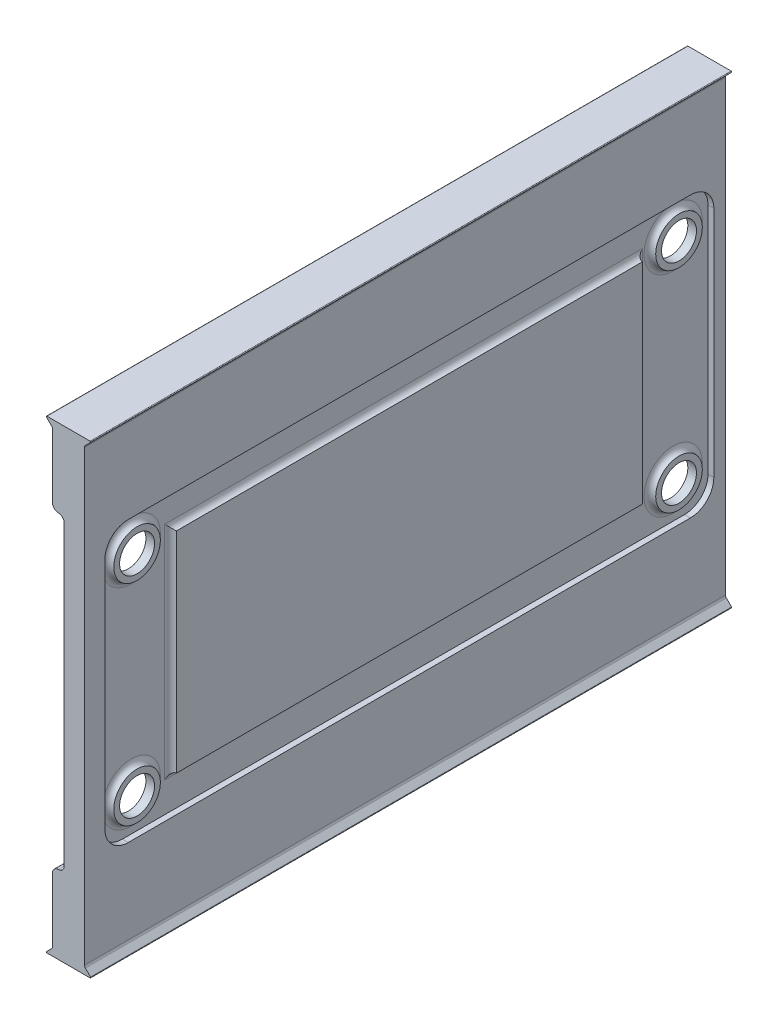
from build123d import *

# Parameters (mm, degrees)
BOSS_EXTRUDE1_DEPTH = 55
SKETCH2_R           = 2
SKETCH2_W           = 40
SKETCH2_H           = 18
CUT_EXTRUDE4_DEPTH  = 0.5
SKETCH7_R           = 1.5
CUT_EXTRUDE7_DEPTH  = 59.595908099
SKETCH8_R           = 3.75
CUT_EXTRUDE8_DEPTH  = 2
SKETCH9_W           = 55
SKETCH9_H           = 26.5
CUT_EXTRUDE9_DEPTH  = 1
FILLET1_R           = 0.5
FILLET2_R           = 0.5
FILLET3_R           = 0.5
FILLET4_R           = 0.5
FILLET5_R           = 0.5


with BuildPart() as part:
    # Sketch1 → Boss-Extrude1 (new body)
    with BuildSketch(Plane.XY):
        with BuildLine():
            Line((-1.854289322, 19.943670675), (1.854289322, 19.943670675))
            ThreePointArc((1.854289322, 19.943670675), (1.900483299, 19.912804847), (1.889644661, 19.858315336))
            Line((1.889644661, 19.858315336), (1.444669914, 19.413340589))
            ThreePointArc((1.444669914, 19.413340589), (1.390476726, 19.332234752), (1.371446609, 19.236563894))
            Line((1.371446609, 19.236563894), (1.371446609, -19.236563894))
            ThreePointArc((1.371446609, -19.236563894), (1.390476726, -19.332234752), (1.444669914, -19.413340589))
            Line((1.444669914, -19.413340589), (1.889644661, -19.858315336))
            ThreePointArc((1.889644661, -19.858315336), (1.900483299, -19.912804847), (1.854289322, -19.943670675))
            Line((1.854289322, -19.943670675), (-1.854289322, -19.943670675))
            ThreePointArc((-1.854289322, -19.943670675), (-1.900483299, -19.912804847), (-1.889644661, -19.858315336))
            Line((-1.889644661, -19.858315336), (-1.444669914, -19.413340589))
            ThreePointArc((-1.444669914, -19.413340589), (-1.390476726, -19.332234752), (-1.371446609, -19.236563894))
            Line((-1.371446609, -19.236563894), (-1.371446609, 19.236563894))
            ThreePointArc((-1.371446609, 19.236563894), (-1.390476726, 19.332234752), (-1.444669914, 19.413340589))
            Line((-1.444669914, 19.413340589), (-1.889644661, 19.858315336))
            ThreePointArc((-1.889644661, 19.858315336), (-1.900483299, 19.912804847), (-1.854289322, 19.943670675))
        make_face()
    extrude(amount=BOSS_EXTRUDE1_DEPTH)

    # Sketch2 → Cut-Extrude4 (cut)
    with BuildSketch(Plane(origin=(1.371446609, 0, 0), x_dir=(0, 0, -1), z_dir=(1, 0, 0))):
        with BuildLine():
            Line((-51.25, 12), (-3, 12))
            ThreePointArc((-3, 12), (-1.585786438, 11.414213562), (-1, 10))
            Line((-1, 10), (-1, -10))
            ThreePointArc((-1, -10), (-1.585786438, -11.414213562), (-3, -12))
            Line((-3, -12), (-51.25, -12))
            ThreePointArc((-51.25, -12), (-52.664213562, -11.414213562), (-53.25, -10))
            Line((-53.25, -10), (-53.25, 10))
            ThreePointArc((-53.25, 10), (-52.664213562, 11.414213562), (-51.25, 12))
        make_face()
        with Locations(Location((-50.488488092, 9.087908505, 0), (0, 0, 90))):
            Circle(SKETCH2_R, mode=Mode.SUBTRACT)
        with Locations(Location((-50.488488092, -8.912091495, 0), (0, 0, 90))):
            Circle(SKETCH2_R, mode=Mode.SUBTRACT)
        with Locations(Location((-3.988488092, -8.912091495, 0), (0, 0, 90))):
            Circle(SKETCH2_R, mode=Mode.SUBTRACT)
        with Locations(Location((-3.988488092, 9.087908505, 0), (0, 0, 90))):
            Circle(SKETCH2_R, mode=Mode.SUBTRACT)
        with Locations((-27.125, 0.087908505)):
            Rectangle(SKETCH2_W, SKETCH2_H, mode=Mode.SUBTRACT)
    extrude(amount=-CUT_EXTRUDE4_DEPTH, mode=Mode.SUBTRACT)

    # Sketch7 → Cut-Extrude7 (cut, through all)
    with BuildSketch(Plane(origin=(1.371446609, 0, 0), x_dir=(0, 0, -1), z_dir=(1, 0, 0))):
        with Locations((-50.488488092, 9.087908505)):
            Circle(SKETCH7_R)
        with Locations((-3.988488092, 9.087908505)):
            Circle(SKETCH7_R)
        with Locations((-3.988488092, -8.912091495)):
            Circle(SKETCH7_R)
        with Locations((-50.488488092, -8.912091495)):
            Circle(SKETCH7_R)
    extrude(amount=-CUT_EXTRUDE7_DEPTH, mode=Mode.SUBTRACT)

    # Sketch8 → Cut-Extrude8 (cut)
    with BuildSketch(Plane.ZY.offset(1.371446609)):
        with Locations(Location((3.988488092, 9.087908505, 0), (0, 0, 270))):
            Circle(SKETCH8_R)
        with Locations(Location((3.988488092, -8.912091495, 0), (0, 0, 270))):
            Circle(SKETCH8_R)
        with Locations(Location((50.488488092, 9.087908505, 0), (0, 0, 270))):
            Circle(SKETCH8_R)
        with Locations(Location((50.488488092, -8.912091495, 0), (0, 0, 270))):
            Circle(SKETCH8_R)
    extrude(amount=-CUT_EXTRUDE8_DEPTH, mode=Mode.SUBTRACT)

    # Sketch9 → Cut-Extrude9 (cut)
    with BuildSketch(Plane.ZY.offset(1.371446609)):
        with Locations((27.5, 0)):
            Rectangle(SKETCH9_W, SKETCH9_H)
    extrude(amount=-CUT_EXTRUDE9_DEPTH, mode=Mode.SUBTRACT)

    # Fillet1
    fillet1_edges = [part.edges().sort_by_distance(p)[0] for p in [
        (-0.371446609, 13.25, 27.5),
        (-0.371446609, -13.25, 27.5),
    ]]
    fillet(fillet1_edges, radius=FILLET1_R)

    # Fillet2
    fillet2_edges = [part.edges().sort_by_distance(p)[0] for p in [
        (-1.371446609, -13.25, 27.5),
        (-1.371446609, 13.25, 27.5),
    ]]
    fillet(fillet2_edges, radius=FILLET2_R - 0.0001)  # a hair under: the kernel refuses the full size

    # Fillet3
    fillet3_edges = [part.edges().sort_by_distance(p)[0] for p in [
        (0.871446609, 7.087908505, 3.988488092),
        (0.871446609, -10.912091495, 3.988488092),
        (0.871446609, -10.912091495, 50.488488092),
        (0.871446609, 7.087908505, 50.488488092),
    ]]
    fillet(fillet3_edges, radius=FILLET3_R - 0.0001)  # a hair under: the kernel refuses the full size

    # Fillet4
    fillet4_edges = [part.edges().sort_by_distance(p)[0] for p in [
        (0.871446609, 0.087908505, 7.125),
        (0.871446609, -8.912091495, 27.125),
        (0.871446609, 9.087908505, 27.125),
        (0.871446609, 0.087908505, 47.125),
    ]]
    fillet(fillet4_edges, radius=FILLET4_R - 0.0001)  # a hair under: the kernel refuses the full size

    # Fillet5
    fillet5_edges = [part.edges().sort_by_distance(p)[0] for p in [
        (0.628553391, -5.162091495, 3.988488092),
        (0.628553391, 12.837908505, 50.488488092),
        (0.628553391, -5.162091495, 50.488488092),
        (0.628553391, 12.837908505, 3.988488092),
    ]]
    fillet(fillet5_edges, radius=FILLET5_R)


solid = part.part
